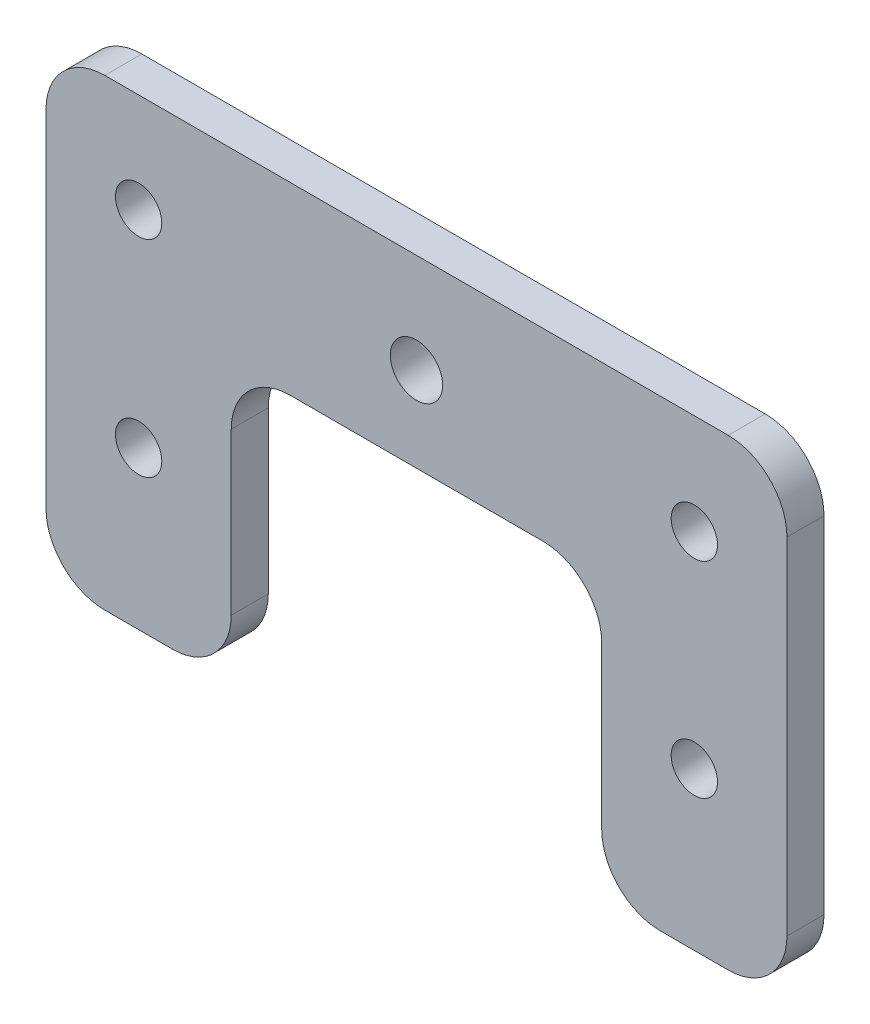
from build123d import *

# Parameters (mm, degrees)
CROQUIS1_R              = 2.821368504
CROQUIS1_R_2            = 2.5
SALIENTE_EXTRUIR1_DEPTH = 4


with BuildPart() as part:
    # Croquis1 → Saliente-Extruir1 (new body)
    with BuildSketch(Plane.XY):
        with BuildLine():
            ThreePointArc((20.188050923, 0.349416954), (22.047922862, 4.839545014), (26.538050923, 6.699416954))
            Line((26.538050923, 6.699416954), (53.838050923, 6.699416954))
            ThreePointArc((53.838050923, 6.699416954), (58.328178983, 4.839545014), (60.188050923, 0.349416954))
            Line((60.188050923, 0.349416954), (60.188050923, -17.045643676))
            ThreePointArc((60.188050923, -17.045643676), (62.047922862, -21.535771736), (66.538050923, -23.395643676))
            Line((66.538050923, -23.395643676), (73.838050923, -23.395643676))
            ThreePointArc((73.838050923, -23.395643676), (78.328178983, -21.535771736), (80.188050923, -17.045643676))
            Line((80.188050923, -17.045643676), (80.188050923, 20.254356324))
            ThreePointArc((80.188050923, 20.254356324), (78.328178983, 24.744484385), (73.838050923, 26.604356324))
            Line((73.838050923, 26.604356324), (6.538050923, 26.604356324))
            ThreePointArc((6.538050923, 26.604356324), (2.047922862, 24.744484385), (0.188050923, 20.254356324))
            Line((0.188050923, 20.254356324), (0.188050923, -17.045643676))
            ThreePointArc((0.188050923, -17.045643676), (2.047922862, -21.535771736), (6.538050923, -23.395643676))
            Line((6.538050923, -23.395643676), (13.838050923, -23.395643676))
            ThreePointArc((13.838050923, -23.395643676), (18.328178983, -21.535771736), (20.188050923, -17.045643676))
            Line((20.188050923, -17.045643676), (20.188050923, 0.349416954))
        make_face()
        with Locations((40.188050923, 15.866498333)):
            Circle(CROQUIS1_R, mode=Mode.SUBTRACT)
        with Locations((10.188050923, -6.395643676)):
            Circle(CROQUIS1_R_2, mode=Mode.SUBTRACT)
        with Locations((10.188050923, 15.866498333)):
            Circle(CROQUIS1_R_2, mode=Mode.SUBTRACT)
        with Locations((70.188050923, -6.395643676)):
            Circle(CROQUIS1_R_2, mode=Mode.SUBTRACT)
        with Locations((70.188050923, 15.771437703)):
            Circle(CROQUIS1_R_2, mode=Mode.SUBTRACT)
    extrude(amount=SALIENTE_EXTRUIR1_DEPTH)


solid = part.part
